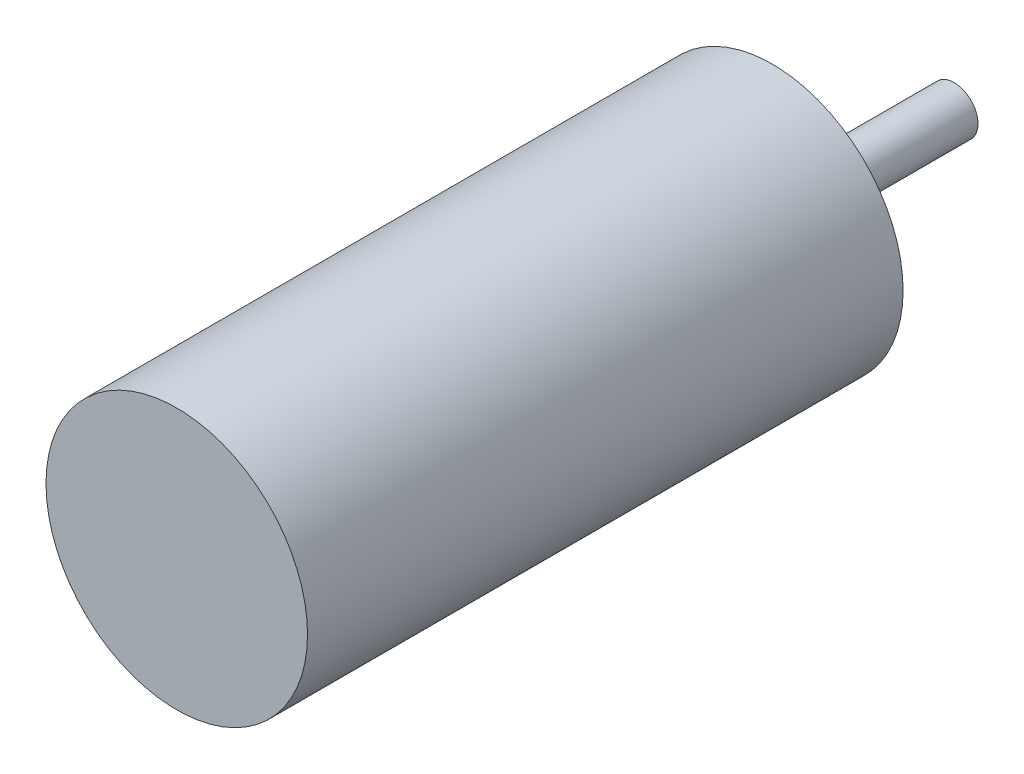
from build123d import *

# Parameters (mm, degrees)
SKETCH1_R               = 10.999999971
SKETCH1_R_2             = 2
BOSS_EXTRUDE4_DEPTH     = 50.1
SKETCH1_6_R             = 2
BOSS_EXTRUDE5_DEPTH     = 15.3
ADVANCEDHOLE1_OUTLINE_R = 1.1
ADVANCEDHOLE1_DEPTH     = 2


# Read off the part's stored shape, not the designer's step: AdvancedHole1
with BuildPart() as part:
    # Sketch1 → Boss-Extrude4 (new body)
    # profile 1 of 2: a face of its own
    with BuildSketch(Plane.XY):
        Circle(SKETCH1_R)
        Circle(SKETCH1_R_2, mode=Mode.SUBTRACT)
    # profile 2 of 2: a face of its own
    with BuildSketch(Plane.XY):
        Circle(SKETCH1_R_2)
    extrude(amount=BOSS_EXTRUDE4_DEPTH)

    # Sketch1<6> → Boss-Extrude5 (add)
    with BuildSketch(Plane.XY):
        Circle(SKETCH1_6_R)
    extrude(amount=-BOSS_EXTRUDE5_DEPTH)

    # AdvancedHole1 outline → AdvancedHole1 (cut)
    with BuildSketch(Plane.XY):
        with Locations((0, -9)):
            Circle(ADVANCEDHOLE1_OUTLINE_R)
        with Locations((-9, 0)):
            Circle(ADVANCEDHOLE1_OUTLINE_R)
        with Locations((0, 9)):
            Circle(ADVANCEDHOLE1_OUTLINE_R)
        with Locations((9, 0)):
            Circle(ADVANCEDHOLE1_OUTLINE_R)
    extrude(amount=ADVANCEDHOLE1_DEPTH, mode=Mode.SUBTRACT)


solid = part.part
